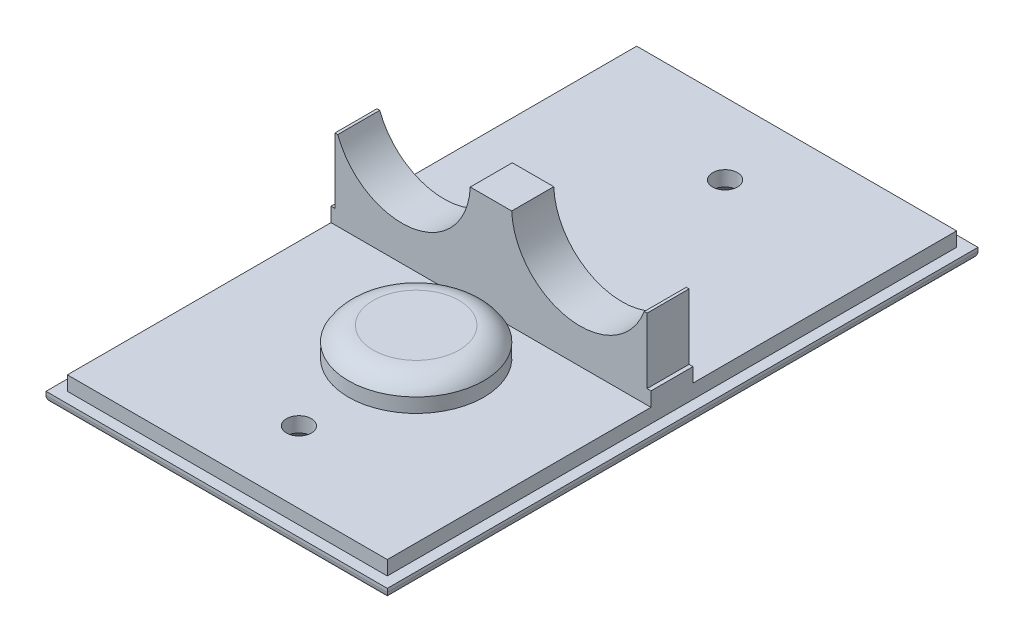
from build123d import *

# Parameters (mm, degrees)
SKETCH_1_W          = 44.9
SKETCH_1_H          = 79.9
EXTRUDE_1_DEPTH     = 4
SKETCH_2_W          = 43.8
SKETCH_2_H          = 5.9
EXTRUDE_2_DEPTH     = 12.5
CUT_EXTRUDE_6_DEPTH = 52.15332345
SKETCH_7_R          = 1.75
CUT_EXTRUDE_7_DEPTH = 48.395642792
SKETCH_8_W          = 47.9
SKETCH_8_H          = 82.9
SKETCH_8_R          = 1.75
EXTRUDE_3_DEPTH     = 1.5
FILLET_1_R          = 1
SKETCH_9_R          = 7.5
CUT_EXTRUDE_8_DEPTH = 52.003588333
CHAMFER_1_SIZE      = 1.4
SKETCH_10_W         = 47.9
SKETCH_10_H         = 38.5
CUT_EXTRUDE_9_DEPTH = 2
SKETCH_11_R         = 9.5
SKETCH_11_R_2       = 7.5
EXTRUDE_1_2_DEPTH   = 2
EXTRUDE_1_2_DRAFT   = 1
SKETCH_12_R         = 9.5
EXTRUDE_4_DEPTH     = 2
FILLET_2_R          = 4
EXTRUDE_5_DEPTH     = 1.5
FILLET_3_R          = 1


with BuildPart() as part:
    # Эскиз1 → Extrude 1 (new body)
    with BuildSketch(Plane(origin=(0, 0, 0), x_dir=(1, 0, 0), z_dir=(0, 1, 0))):
        Rectangle(SKETCH_1_W, SKETCH_1_H)
    extrude(amount=EXTRUDE_1_DEPTH)

    # Эскиз2 → Бобышка-Вытянуть2 (add)
    with BuildSketch(Plane(origin=(0, 4, 0), x_dir=(1, 0, 0), z_dir=(0, 1, 0))):
        Rectangle(SKETCH_2_W, SKETCH_2_H)
    extrude(amount=EXTRUDE_2_DEPTH)

    # Эскиз3 → Вырез-Вытянуть6 (cut, through all)
    with BuildSketch(Plane.XY.offset(2.95)):
        with BuildLine():
            Line((-2.908454638, 16.097187923), (2.908454638, 16.097187923))
            ThreePointArc((2.908454638, 16.097187923), (11.009669484, 7.016387031), (21.505675783, 13.174672393))
            Line((21.505675783, 13.174672393), (23.649512702, 13.174672393))
            Line((23.649512702, 13.174672393), (22.1, 16.5))
            ThreePointArc((22.1, 16.5), (19.288225099, 23.288225099), (12.5, 26.1))
            Line((12.5, 26.1), (-12.5, 26.1))
            ThreePointArc((-12.5, 26.1), (-19.288225099, 23.288225099), (-22.1, 16.5))
            Line((-22.1, 16.5), (-23.550546649, 13.174672393))
            Line((-23.550546649, 13.174672393), (-21.505675783, 13.174672393))
            ThreePointArc((-21.505675783, 13.174672393), (-11.009669484, 7.016387031), (-2.908454638, 16.097187923))
        make_face()
    extrude(amount=-CUT_EXTRUDE_6_DEPTH, mode=Mode.SUBTRACT)

    # Эскиз7 → Вырез-Вытянуть7 (cut, through all)
    with BuildSketch(Plane(origin=(0, 4, 0), x_dir=(1, 0, 0), z_dir=(0, 1, 0))):
        with Locations(Location((0, -29.9, 0), (0, 0, 270))):
            Circle(SKETCH_7_R)
        with Locations(Location((0, 29.9, 0), (0, 0, 270))):
            Circle(SKETCH_7_R)
    extrude(amount=-CUT_EXTRUDE_7_DEPTH, mode=Mode.SUBTRACT)

    # Эскиз8 → Бобышка-Вытянуть3 (add)
    with BuildSketch(Plane.XZ):
        Rectangle(SKETCH_8_W, SKETCH_8_H)
        with Locations(Location((0, 29.9, 0), (0, 0, 90))):
            Circle(SKETCH_8_R, mode=Mode.SUBTRACT)
        with Locations(Location((0, -29.9, 0), (0, 0, 90))):
            Circle(SKETCH_8_R, mode=Mode.SUBTRACT)
    extrude(amount=EXTRUDE_3_DEPTH)

    # Скругление1
    fillet_1_edges = [part.edges().sort_by_distance(p)[0] for p in [
        (-23.95, -1.5, 0),
        (0, -1.5, -41.45),
        (23.95, -1.5, 0),
        (0, -1.5, 41.45),
    ]]
    fillet(fillet_1_edges, radius=FILLET_1_R)

    # Эскиз9 → Вырез-Вытянуть8 (cut, through all)
    with BuildSketch(Plane.XZ.offset(1.5)):
        with Locations(Location((0, 13.45, 0), (0, 0, 270))):
            Circle(SKETCH_9_R)
    extrude(amount=-CUT_EXTRUDE_8_DEPTH, mode=Mode.SUBTRACT)

    # Фаска1
    chamfer_1_edges = [part.edges().sort_by_distance(p)[0] for p in [
        (0, -1.5, 28.15),
        (0, -1.5, -31.65),
    ]]
    chamfer(chamfer_1_edges, length=CHAMFER_1_SIZE)

    # Эскиз10 → Вырез-Вытянуть9 (cut)
    with BuildSketch(Plane(origin=(0, 4, 0), x_dir=(1, 0, 0), z_dir=(0, 1, 0))):
        with Locations((0, 22.2)):
            Rectangle(SKETCH_10_W, SKETCH_10_H)
        with Locations((0, -22.2)):
            Rectangle(SKETCH_10_W, SKETCH_10_H)
    extrude(amount=-CUT_EXTRUDE_9_DEPTH, mode=Mode.SUBTRACT)


with BuildPart() as extrude_1_2_tool:
    # Эскиз11 → Extrude 1 2 (with draft: the straight prism first)
    with BuildSketch(Plane(origin=(0, 2, 0), x_dir=(1, 0, 0), z_dir=(0, 1, 0))):
        with Locations((0, -13.45)):
            Circle(SKETCH_11_R)
        with Locations((0, -13.45)):
            Circle(SKETCH_11_R_2, mode=Mode.SUBTRACT)
    extrude(amount=EXTRUDE_1_2_DEPTH)
    # Extrude 1 2: the draft: its side faces are tilted about the plane it starts from
    extrude_1_2_sides = [extrude_1_2_tool.faces().sort_by_distance(p)[0] for p in [
        (-9.5, 3, 13.45),
        (-7.5, 3, 13.45),
    ]]
    draft(extrude_1_2_sides, Plane(origin=(0, 2, 0), x_dir=(1, 0, 0), z_dir=(0, 1, 0)), EXTRUDE_1_2_DRAFT)


with BuildPart() as part_1:
    add(part.part)

    # Extrude 1 2: add extrude_1_2_tool
    add(extrude_1_2_tool.part)

    # Эскиз12 → Бобышка-Вытянуть4 (add)
    with BuildSketch(Plane(origin=(0, 4, 0), x_dir=(1, 0, 0), z_dir=(0, 1, 0))):
        with Locations(Location((0, -13.45, 0), (0, 0, 270))):
            Circle(SKETCH_12_R)
    extrude(amount=EXTRUDE_4_DEPTH)

    # Скругление2
    # the kernel refuses this fillet: 4 mm, written as the material it takes off along each edge
    with BuildSketch(Plane(origin=(0, 6, 13.45), x_dir=(0, 0, 1), z_dir=(-1, 0, 0))) as fillet_2_piece_1:
        with BuildLine():
            CenterArc((6.035898385, -4), FILLET_2_R, 30, 60)
            Line((6.035898385, 0), (6.035898385, 0.08))
            Line((6.035898385, 0.08), (9.5, 0.08))
            Line((9.5, 0.08), (9.58, 0))
            ThreePointArc((9.58, 0), (9.58, -1), (9.569282032, -1.96))
            Line((9.569282032, -1.96), (9.5, -2))
        make_face()
    revolve(axis=Axis((0, 6, 13.45), (0, 1, 0)), mode=Mode.SUBTRACT)
    # the kernel refuses this fillet: 4 mm, written as the material it takes off along each edge
    with BuildSketch(Plane(origin=(0, 2, 13.45), x_dir=(0.9999318130918542, 0, -0.011677720960747706), z_dir=(-0.011677720960747706, 0, -0.9999318130918542))) as fillet_2_2_piece_1:
        with BuildLine():
            CenterArc((7.5 + FILLET_2_R, FILLET_2_R * 0.00872686779076), FILLET_2_R, 180, 1)
            Line((7.5 + FILLET_2_R * 0.000152304843608, -FILLET_2_R * 0.00872553864652), (7.5 - FILLET_2_R * 0.0198446490595, -FILLET_2_R * 0.00907458677527))
            Line((7.5 - FILLET_2_R * 0.0198446490595, -FILLET_2_R * 0.00907458677527), (7.5 - FILLET_2_R * 0.02, -FILLET_2_R * 0.000174537355815))
            Line((7.5 - FILLET_2_R * 0.02, -FILLET_2_R * 0.000174537355815), (7.5 - FILLET_2_R * 0.02, FILLET_2_R * 0.00872686779076))
            Line((7.5 - FILLET_2_R * 0.02, FILLET_2_R * 0.00872686779076), (7.5, FILLET_2_R * 0.00872686779076))
        make_face()
    revolve(axis=Axis((0, 2, 13.45), (0, -1, 0)), revolution_arc=271.338198667, mode=Mode.SUBTRACT)
    # the kernel refuses this fillet: 4 mm, written as the material it adds along each edge
    with BuildSketch(Plane(origin=(0, 4, 13.45), x_dir=(1, 0, 0), z_dir=(0, 0, 1))) as fillet_2_3_piece_1_section:
        with BuildLine():
            CenterArc((3.5, -4), FILLET_2_R, 0, 90)
            Line((3.5, 0), (3.5, 0.4))
            Line((3.5, 0.4), (7.53491013, 0.4))
            Line((7.53491013, 0.4), (7.934849208, -0.006980963))
            ThreePointArc((7.934849208, -0.006980963), (7.9, -2.034907471), (7.9, -4))
            Line((7.9, -4), (7.5, -4))
        make_face()
    fillet_2_3_piece_1 = revolve(axis=Axis((0, 4, 13.45), (0, 1, 0)), mode=Mode.PRIVATE)
    fillet_2_3_piece_1 = split(fillet_2_3_piece_1, bisect_by=Plane(origin=(0, 4, 13.45), z_dir=(0.011677720960747706, 0, 0.9999318130918542)), keep=Keep.TOP, mode=Mode.PRIVATE)
    fillet_2_3_piece_1 = split(fillet_2_3_piece_1, bisect_by=Plane(origin=(0, 4, 13.45), z_dir=(0.9999318130918542, 0, 0.011677720960747469)), keep=Keep.TOP, mode=Mode.PRIVATE)
    add(fillet_2_3_piece_1)
    with BuildSketch(Plane(origin=(0, 4, 13.45), x_dir=(1, 0, 0), z_dir=(0, 0, 1))) as fillet_2_3_piece_2_section:
        with BuildLine():
            CenterArc((3.5, -4), FILLET_2_R, 0, 90)
            Line((3.5, 0), (3.5, 0.4))
            Line((3.5, 0.4), (7.53491013, 0.4))
            Line((7.53491013, 0.4), (7.934849208, -0.006980963))
            ThreePointArc((7.934849208, -0.006980963), (7.9, -2.034907471), (7.9, -4))
            Line((7.9, -4), (7.5, -4))
        make_face()
    fillet_2_3_piece_2 = revolve(axis=Axis((0, 4, 13.45), (0, 1, 0)), mode=Mode.PRIVATE)
    fillet_2_3_piece_2 = split(fillet_2_3_piece_2, bisect_by=Plane(origin=(0, 4, 13.45), z_dir=(-0.011677720960747706, 0, -0.9999318130918542)), keep=Keep.TOP, mode=Mode.PRIVATE)
    fillet_2_3_piece_2 = split(fillet_2_3_piece_2, bisect_by=Plane(origin=(0, 4, 13.45), z_dir=(0.9999318130918542, 0, 0.011677720960747469)), keep=Keep.TOP, mode=Mode.PRIVATE)
    add(fillet_2_3_piece_2)
    with BuildSketch(Plane(origin=(0, 4, 13.45), x_dir=(1, 0, 0), z_dir=(0, 0, 1))) as fillet_2_3_piece_3_section:
        with BuildLine():
            CenterArc((3.5, -4), FILLET_2_R, 0, 90)
            Line((3.5, 0), (3.5, 0.4))
            Line((3.5, 0.4), (7.53491013, 0.4))
            Line((7.53491013, 0.4), (7.934849208, -0.006980963))
            ThreePointArc((7.934849208, -0.006980963), (7.9, -2.034907471), (7.9, -4))
            Line((7.9, -4), (7.5, -4))
        make_face()
    fillet_2_3_piece_3 = revolve(axis=Axis((0, 4, 13.45), (0, 1, 0)), mode=Mode.PRIVATE)
    fillet_2_3_piece_3 = split(fillet_2_3_piece_3, bisect_by=Plane(origin=(0, 4, 13.45), z_dir=(0.011677720960747706, 0, 0.9999318130918542)), keep=Keep.TOP, mode=Mode.PRIVATE)
    fillet_2_3_piece_3 = split(fillet_2_3_piece_3, bisect_by=Plane(origin=(0, 4, 13.45), z_dir=(-0.9999318130918542, 0, -0.011677720960747469)), keep=Keep.TOP, mode=Mode.PRIVATE)
    add(fillet_2_3_piece_3)
    with BuildSketch(Plane(origin=(0, 4, 13.45), x_dir=(1, 0, 0), z_dir=(0, 0, 1))) as fillet_2_3_piece_4_section:
        with BuildLine():
            CenterArc((3.5, -4), FILLET_2_R, 0, 90)
            Line((3.5, 0), (3.5, 0.4))
            Line((3.5, 0.4), (7.53491013, 0.4))
            Line((7.53491013, 0.4), (7.934849208, -0.006980963))
            ThreePointArc((7.934849208, -0.006980963), (7.9, -2.034907471), (7.9, -4))
            Line((7.9, -4), (7.5, -4))
        make_face()
    fillet_2_3_piece_4 = revolve(axis=Axis((0, 4, 13.45), (0, 1, 0)), mode=Mode.PRIVATE)
    fillet_2_3_piece_4 = split(fillet_2_3_piece_4, bisect_by=Plane(origin=(0, 4, 13.45), z_dir=(-0.011677720960747706, 0, -0.9999318130918542)), keep=Keep.TOP, mode=Mode.PRIVATE)
    fillet_2_3_piece_4 = split(fillet_2_3_piece_4, bisect_by=Plane(origin=(0, 4, 13.45), z_dir=(-0.9999318130918542, 0, -0.011677720960747469)), keep=Keep.TOP, mode=Mode.PRIVATE)
    add(fillet_2_3_piece_4)

    # Эскиз13 → Бобышка-Вытянуть5 (add)
    with BuildSketch(Plane.XZ.offset(1.5)):
        with BuildLine():
            Line((-11, 20.95), (-11, 3.952706076))
            Line((-11, 3.952706076), (11, 3.952706076))
            Line((11, 3.952706076), (11, 20.95))
            ThreePointArc((11, 20.95), (0, 9.95), (-11, 20.95))
        make_face()
    extrude(amount=-EXTRUDE_5_DEPTH)

    # Скругление3
    # the kernel refuses this fillet: 1 mm, written as the material it takes off along each edge
    with BuildSketch(Plane(origin=(0, 0, 20.95), x_dir=(0.827668100134072, 0, -0.5612178864046082), z_dir=(0.5612178864046082, 0, 0.827668100134072))) as fillet_3_piece_1_section:
        with BuildLine():
            CenterArc((11 + FILLET_3_R, -FILLET_3_R), FILLET_3_R, 90, 90)
            Line((11 + FILLET_3_R, 0), (11, 0))
            Line((11, 0), (11, -FILLET_3_R))
        make_face()
    fillet_3_piece_1 = revolve(axis=Axis((0, 0, 20.95), (0, 1, 0)), revolution_arc=111.719870778, mode=Mode.PRIVATE)
    fillet_3_piece_1 = fillet_3_piece_1 & Plane(origin=(0, 0, 13.45), x_dir=(0, 0, -1), z_dir=(0, -1, 0)) * Cylinder(7.5, 49, mode=Mode.PRIVATE)
    add(fillet_3_piece_1, mode=Mode.SUBTRACT)


solid = part_1.part
